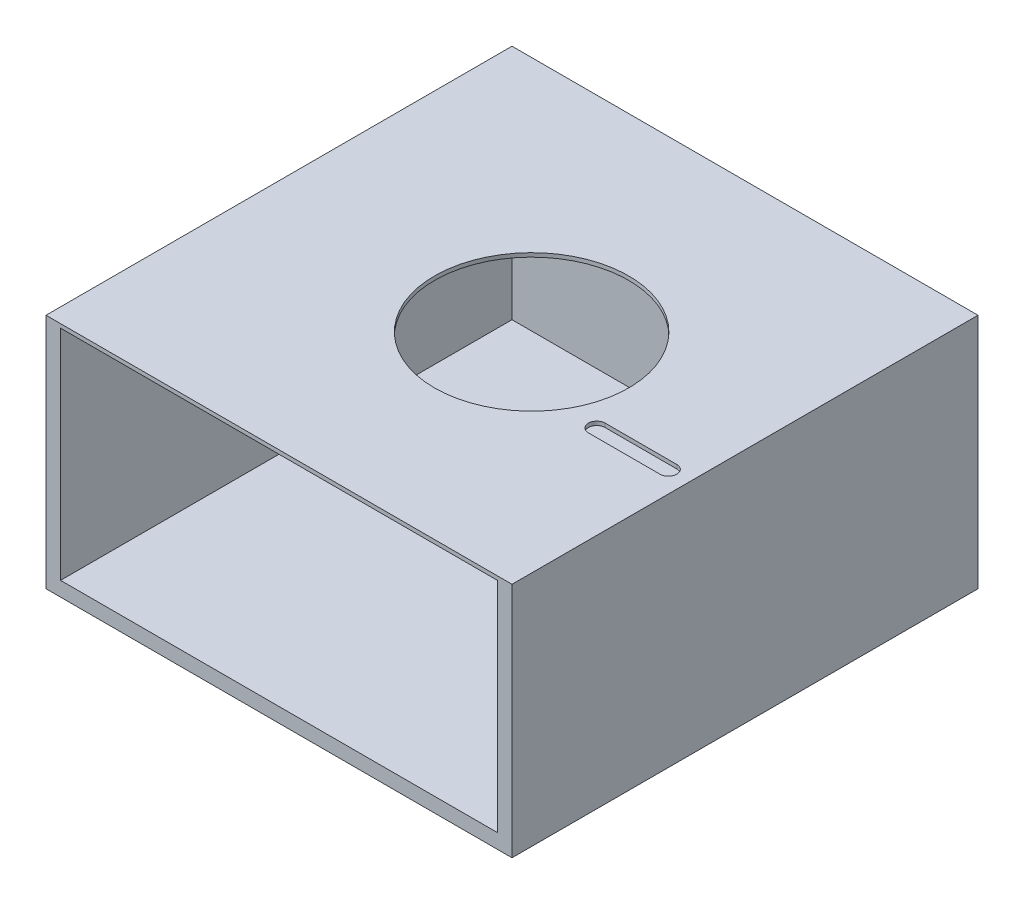
from build123d import *

# Parameters (mm, degrees)
SKETCH1_W           = 304.8
SKETCH1_H           = 152.4
BOSS_EXTRUDE1_DEPTH = 304.8
SHELL1_T            = -9.525
BOSS_EXTRUDE2_DEPTH = 2.54
SKETCH4_R           = 63.5
CUT_EXTRUDE1_DEPTH  = 7.62
CUT_EXTRUDE3_DEPTH  = 2.54


with BuildPart() as part:
    # Sketch1 → Boss-Extrude1 (new body)
    with BuildSketch(Plane.XY):
        Rectangle(SKETCH1_W, SKETCH1_H)
    extrude(amount=BOSS_EXTRUDE1_DEPTH)

    # Shell1
    shell1_openings = [part.faces().sort_by_distance(p)[0] for p in [
        (0, 0, 304.8),
        (0, 76.2, 152.4),
    ]]
    offset(amount=SHELL1_T, openings=shell1_openings, kind=Kind.INTERSECTION)

    # Sketch2 → Boss-Extrude2 (add)
    with BuildSketch(Plane(origin=(0, 76.2, 0), x_dir=(1, 0, 0), z_dir=(0, 1, 0))):
        Polygon((-142.875, -304.8), (142.875, -304.8), (152.4, -304.8), (152.4, 0), (-152.4, 0), (-152.4, -304.8), align=None)
    extrude(amount=BOSS_EXTRUDE2_DEPTH)

    # Sketch4 → Cut-Extrude1 (cut)
    with BuildSketch(Plane(origin=(0, 78.74, 0), x_dir=(1, 0, 0), z_dir=(0, 1, 0))):
        with Locations((15.875, -155.428881859)):
            Circle(SKETCH4_R)
    extrude(amount=-CUT_EXTRUDE1_DEPTH, mode=Mode.SUBTRACT)

    # Sketch9 → Cut-Extrude3 (cut)
    with BuildSketch(Plane(origin=(0, 78.74, 0), x_dir=(1, 0, 0), z_dir=(0, 1, 0))):
        with BuildLine():
            Line((138.437451516, -194.04995316), (91.580762502, -194.04995316))
            ThreePointArc((91.580762502, -194.04995316), (86.070907327, -188.540097985), (91.580762502, -183.03024281))
            Line((91.580762502, -183.03024281), (138.437451516, -183.03024281))
            ThreePointArc((138.437451516, -183.03024281), (143.947306691, -188.540097985), (138.437451516, -194.04995316))
        make_face()
    extrude(amount=-CUT_EXTRUDE3_DEPTH, mode=Mode.SUBTRACT)


solid = part.part
